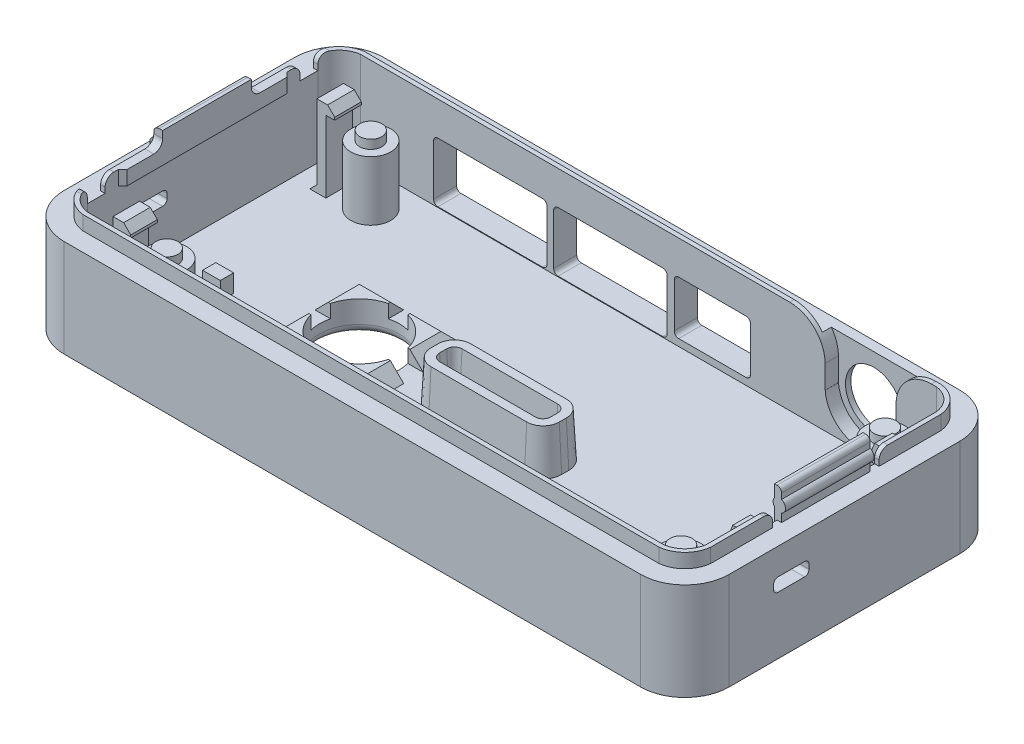
from build123d import *
from OCP.BRepFilletAPI import BRepFilletAPI_MakeChamfer

# Parameters (mm, degrees)
EXTRUDE_2_DEPTH       = 11
EXTRUDE_4_DEPTH       = 1.6
CUT_EXTRUDE_START     = -9
CUT_EXTRUDE_2_DEPTH   = 9
EXTRUDE_12_DEPTH      = 1.6
EXTRUDE_12_DEPTH_BACK = 2
SKETCH_5_W            = 0.3
SKETCH_5_H            = 10
SKETCH_15_R           = 2.25
EXTRUDE_13_DEPTH      = 6.7
SKETCH_16_R           = 1.25
EXTRUDE_14_DEPTH      = 1
SKETCH_17_W           = 0.5
SKETCH_17_H           = 1
CUT_EXTRUDE_3_DEPTH   = 1.6
SKETCH_19_W           = 0.8
SKETCH_19_H           = 10
EXTRUDE_15_DEPTH      = 1.8
SKETCH_20_R           = 0.7
EXTRUDE_16_DEPTH      = 10
FILLET_4_R            = 0.5
SKETCH_39_R           = 4
CUT_EXTRUDE_4_DEPTH   = 0.5
SKETCH_41_W           = 8.6
SKETCH_41_H           = 6
SKETCH_41_W_2         = 12.8
SKETCH_41_H_2         = 6.7
CUT_EXTRUDE_5_DEPTH   = 12
SKETCH_42_R           = 3.2
CUT_EXTRUDE_6_DEPTH   = 1.6
SKETCH_46_W           = 20
SKETCH_46_H           = 1.6
EXTRUDE_19_DEPTH      = 0.5
CHAMFER_3_SIZE        = 1
SKETCH_48_W           = 1
SKETCH_48_H           = 10
EXTRUDE_21_DEPTH      = 1.8
SKETCH_49_R           = 0.7
EXTRUDE_22_DEPTH      = 10
SKETCH_50_W           = 0.5
SKETCH_50_H           = 2
CUT_EXTRUDE_10_DEPTH  = 1.6
FILLET_9_R            = 1
FILLET_10_R           = 0.6
SKETCH_51_W           = 12
SKETCH_51_H           = 2
CUT_EXTRUDE_11_DEPTH  = 2
FILLET_13_R           = 0.6
SKETCH_52_W           = 9.2
SKETCH_52_H           = 9.2
EXTRUDE_23_DEPTH      = 1.5
CHAMFER_5_SIZE        = 1.5
CUT_EXTRUDE_12_REACH  = 47.339
SKETCH_53_R           = 4.5
FILLET_14_R           = 1
SKETCH_55_W           = 12.2
SKETCH_55_H           = 2.2
CUT_EXTRUDE_13_DEPTH  = 1.5
SKETCH_56_W           = 2.2
SKETCH_56_H           = 12.2
CUT_EXTRUDE_14_DEPTH  = 1.5
FILLET_17_R           = 1
SKETCH_63_W           = 2
SKETCH_63_H           = 1.5
EXTRUDE_24_DEPTH      = 2
FILLET_18_R           = 0.5
EXTRUDE_27_DEPTH      = 5
EXTRUDE_27_TAPER      = 3
CUT_EXTRUDE_15_DEPTH  = 0.5
CUT_EXTRUDE_16_REACH  = 80.462
SKETCH_67_W           = 4
SKETCH_67_H           = 1.5
FILLET_20_R           = 0.5
CUT_EXTRUDE_17_REACH  = 77.981
CUT_EXTRUDE_18_DEPTH  = 5
CUT_EXTRUDE_18_DRAFT  = 3
SKETCH_71_W           = 2
SKETCH_71_H           = 2
EXTRUDE_28_DEPTH      = 1.8
CHAMFER_6_SIZE        = 0.8
CHAMFER_6_SIZE2       = 1.980069483
SKETCH_73_W           = 1
SKETCH_73_H           = 3
EXTRUDE_30_DEPTH      = 9.2
SKETCH_74_W           = 3
SKETCH_74_H           = 1.1
EXTRUDE_31_DEPTH      = 1
CHAMFER_7_SIZE        = 0.8
CUT_EXTRUDE_START_2   = -1.5
SKETCH_75_R           = 4
CUT_EXTRUDE_19_DEPTH  = 1.5
SKETCH_76_W           = 8
SKETCH_76_H           = 6.611690882
CUT_EXTRUDE_20_DEPTH  = 1.5
FILLET_21_R           = 4


# Some blends are built 0.0001 mm under size
with BuildPart() as part:
    # case 2 → 凸台-拉伸2 (new body)
    with BuildSketch(Plane(origin=(0, 0, 0), x_dir=(1, 0, 0), z_dir=(0, 1, 0))):
        with BuildLine():
            Line((-34.042196447, 18), (30.957803553, 18))
            ThreePointArc((30.957803553, 18), (34.493337459, 16.535533906), (35.957803553, 13))
            Line((35.957803553, 13), (35.957803553, -13))
            ThreePointArc((35.957803553, -13), (34.493337459, -16.535533906), (30.957803553, -18))
            Line((30.957803553, -18), (-34.042196447, -18))
            ThreePointArc((-34.042196447, -18), (-37.577730353, -16.535533906), (-39.042196447, -13))
            Line((-39.042196447, -13), (-39.042196447, 13))
            ThreePointArc((-39.042196447, 13), (-37.577730353, 16.535533906), (-34.042196447, 18))
        make_face()
    extrude(amount=EXTRUDE_2_DEPTH)

    # 草图3 → 凸台-拉伸4 (add)
    with BuildSketch(Plane(origin=(0, 11, 0), x_dir=(1, 0, 0), z_dir=(0, 1, 0))):
        with BuildLine():
            Line((-36.942196447, 13), (-36.942196447, -13))
            ThreePointArc((-36.942196447, -13), (-35.997398295, -14.955201848), (-34.042196447, -15.9))
            Line((-34.042196447, -15.9), (30.957803553, -15.9))
            ThreePointArc((30.957803553, -15.9), (32.913005401, -14.955201848), (33.857803553, -13))
            Line((33.857803553, -13), (33.857803553, 13))
            ThreePointArc((33.857803553, 13), (32.913005401, 14.955201848), (30.957803553, 15.9))
            Line((30.957803553, 15.9), (-34.042196447, 15.9))
            ThreePointArc((-34.042196447, 15.9), (-35.997398295, 14.955201848), (-36.942196447, 13))
        make_face()
        with BuildLine():
            Line((-34.042196447, -15.4), (30.957803553, -15.4))
            ThreePointArc((30.957803553, -15.4), (32.562900965, -14.605097413), (33.357803553, -13))
            Line((33.357803553, -13), (33.357803553, 13))
            ThreePointArc((33.357803553, 13), (32.562900965, 14.605097413), (30.957803553, 15.4))
            Line((30.957803553, 15.4), (-34.042196447, 15.4))
            ThreePointArc((-34.042196447, 15.4), (-35.64729386, 14.605097413), (-36.442196447, 13))
            Line((-36.442196447, 13), (-36.442196447, -13))
            ThreePointArc((-36.442196447, -13), (-35.64729386, -14.605097413), (-34.042196447, -15.4))
        make_face(mode=Mode.SUBTRACT)
    extrude(amount=EXTRUDE_4_DEPTH)

    # 草图14 → 切除-拉伸2 (cut)
    with BuildSketch(Plane(origin=(0, 11, 0), x_dir=(1, 0, 0), z_dir=(0, 1, 0)).offset(CUT_EXTRUDE_START)):
        with BuildLine():
            Line((-34.042196447, -15.4), (30.957803553, -15.4))
            ThreePointArc((30.957803553, -15.4), (32.562900965, -14.605097413), (33.357803553, -13))
            Line((33.357803553, -13), (33.357803553, 13))
            ThreePointArc((33.357803553, 13), (32.562900965, 14.605097413), (30.957803553, 15.4))
            Line((30.957803553, 15.4), (-34.042196447, 15.4))
            ThreePointArc((-34.042196447, 15.4), (-35.64729386, 14.605097413), (-36.442196447, 13))
            Line((-36.442196447, 13), (-36.442196447, -13))
            ThreePointArc((-36.442196447, -13), (-35.64729386, -14.605097413), (-34.042196447, -15.4))
        make_face()
    extrude(amount=CUT_EXTRUDE_2_DEPTH, mode=Mode.SUBTRACT)

    # 草图5 → 凸台-拉伸12 (add, two sides: drawn at the far end of the back side and taken through both)
    with BuildSketch(Plane(origin=(0, 11, 0), x_dir=(1, 0, 0), z_dir=(0, 1, 0)).offset(-EXTRUDE_12_DEPTH_BACK)):
        with Locations((33.207803553, 0)):
            Rectangle(SKETCH_5_W, SKETCH_5_H)
    extrude(amount=EXTRUDE_12_DEPTH + EXTRUDE_12_DEPTH_BACK)

    # 草图15 → 凸台-拉伸13 (add)
    with BuildSketch(Plane(origin=(0, 2, 0), x_dir=(1, 0, 0), z_dir=(0, 1, 0))):
        with Locations(Location((29.060337171, -11.529492838, 0), (0, 0, 270))):
            Circle(SKETCH_15_R)
        with Locations(Location((-28.939662829, -11.529492838, 0), (0, 0, 270))):
            Circle(SKETCH_15_R)
        with Locations(Location((29.060337171, 11.470507162, 0), (0, 0, 270))):
            Circle(SKETCH_15_R)
        with Locations(Location((-28.939662829, 11.470507162, 0), (0, 0, 270))):
            Circle(SKETCH_15_R)
    extrude(amount=EXTRUDE_13_DEPTH)

    # 草图16 → 凸台-拉伸14 (add)
    with BuildSketch(Plane(origin=(0, 8.7, 0), x_dir=(1, 0, 0), z_dir=(0, 1, 0))):
        with Locations(Location((29.060337171, -11.529492838, 0), (0, 0, 270))):
            Circle(SKETCH_16_R)
        with Locations(Location((29.060337171, 11.470507162, 0), (0, 0, 270))):
            Circle(SKETCH_16_R)
        with Locations(Location((-28.939662829, -11.529492838, 0), (0, 0, 270))):
            Circle(SKETCH_16_R)
        with Locations(Location((-28.939662829, 11.470507162, 0), (0, 0, 270))):
            Circle(SKETCH_16_R)
    extrude(amount=EXTRUDE_14_DEPTH)

    # 草图17 → 切除-拉伸3 (cut)
    with BuildSketch(Plane(origin=(0, 12.6, 0), x_dir=(1, 0, 0), z_dir=(0, 1, 0))):
        with Locations((33.607803553, -5.5)):
            Rectangle(SKETCH_17_W, SKETCH_17_H)
        with Locations((33.607803553, 5.5)):
            Rectangle(SKETCH_17_W, SKETCH_17_H)
    extrude(amount=-CUT_EXTRUDE_3_DEPTH, mode=Mode.SUBTRACT)

    # 草图19 → 凸台-拉伸15 (add)
    with BuildSketch(Plane(origin=(0, 12.6, 0), x_dir=(1, 0, 0), z_dir=(0, 1, 0))):
        with Locations((33.457803553, 0)):
            Rectangle(SKETCH_19_W, SKETCH_19_H)
    extrude(amount=EXTRUDE_15_DEPTH)

    # 草图20 → 凸台-拉伸16 (add)
    with BuildSketch(Plane(origin=(0, 0, -5), x_dir=(-1, 0, 0), z_dir=(0, 0, -1))):
        with Locations((-33.607803553, 12.6)):
            Circle(SKETCH_20_R)
    extrude(amount=-EXTRUDE_16_DEPTH)

    # 圆角4
    fillet_4_edges = [part.edges().sort_by_distance(p)[0] for p in [
        (33.857803553, 14.4, 0),
    ]]
    fillet(fillet_4_edges, radius=FILLET_4_R)

    # 草图39 → 切除-拉伸4 (cut)
    with BuildSketch(Plane(origin=(0, 0, -18), x_dir=(-1, 0, 0), z_dir=(0, 0, -1))):
        with Locations((-22.372090091, 6.27888613)):
            Circle(SKETCH_39_R)
    extrude(amount=-CUT_EXTRUDE_4_DEPTH, mode=Mode.SUBTRACT)

    # 草图41 → 切除-拉伸5 (cut)
    with BuildSketch(Plane(origin=(0, 0, -18), x_dir=(-1, 0, 0), z_dir=(0, 0, -1))):
        with Locations((-5.657803553, 5.77888613)):
            Rectangle(SKETCH_41_W, SKETCH_41_H)
        with Locations((5.842196447, 5.42888613)):
            Rectangle(SKETCH_41_W_2, SKETCH_41_H_2)
        with Locations((19.392196447, 5.42888613)):
            Rectangle(SKETCH_41_W_2, SKETCH_41_H_2)
    extrude(amount=-CUT_EXTRUDE_5_DEPTH, mode=Mode.SUBTRACT)

    # 草图42 → 切除-拉伸6 (cut)
    with BuildSketch(Plane(origin=(0, 0, -17.5), x_dir=(-1, 0, 0), z_dir=(0, 0, -1))):
        with Locations((-22.372090091, 6.27888613)):
            Circle(SKETCH_42_R)
    extrude(amount=-CUT_EXTRUDE_6_DEPTH, mode=Mode.SUBTRACT)

    # 草图46 → 凸台-拉伸19 (add)
    with BuildSketch(Plane(origin=(-36.442196447, 0, 0), x_dir=(0, 0, -1), z_dir=(1, 0, 0))):
        with Locations((0, 11.8)):
            Rectangle(SKETCH_46_W, SKETCH_46_H)
    extrude(amount=EXTRUDE_19_DEPTH)

    # 倒角3
    # the kernel refuses this chamfer: 1 mm, written as the material it takes off along each edge
    with BuildSketch(Plane(origin=(-35.942196447, 15.171682988, -10), x_dir=(-0.9996219169112968, 0, -0.02749587661058555), z_dir=(0, -1, 0))) as chamfer_3_piece_1_section:
        Polygon((CHAMFER_3_SIZE * 0.999621916911, -CHAMFER_3_SIZE * 0.0274958766106), (-CHAMFER_3_SIZE * 0.0274958766106, -CHAMFER_3_SIZE * 0.999621916911), (0, 0), align=None)
    chamfer_3_piece_1 = extrude(amount=6.743365976, mode=Mode.PRIVATE)
    chamfer_3_piece_1 = split(chamfer_3_piece_1, bisect_by=Plane(origin=(-36.442196447, 11.8, -9.606598916), z_dir=(1, 0, 0)), keep=Keep.TOP, mode=Mode.PRIVATE)
    add(chamfer_3_piece_1, mode=Mode.SUBTRACT)
    with BuildSketch(Plane(origin=(-35.942196447, 8.428317012, 10), x_dir=(-0.9996219169112968, 0, 0.02749587661058555), z_dir=(0, 1, 0))) as chamfer_3_piece_2_section:
        Polygon((CHAMFER_3_SIZE * 0.999621916911, -CHAMFER_3_SIZE * 0.0274958766106), (-CHAMFER_3_SIZE * 0.0274958766106, -CHAMFER_3_SIZE * 0.999621916911), (0, 0), align=None)
    chamfer_3_piece_2 = extrude(amount=6.743365976, mode=Mode.PRIVATE)
    chamfer_3_piece_2 = split(chamfer_3_piece_2, bisect_by=Plane(origin=(-36.442196447, 11.8, 9.606598916), z_dir=(1, 0, 0)), keep=Keep.TOP, mode=Mode.PRIVATE)
    add(chamfer_3_piece_2, mode=Mode.SUBTRACT)

    # 草图48 → 凸台-拉伸21 (add)
    with BuildSketch(Plane(origin=(0, 12.6, 0), x_dir=(1, 0, 0), z_dir=(0, 1, 0))):
        with Locations((-36.442196447, 0)):
            Rectangle(SKETCH_48_W, SKETCH_48_H)
    extrude(amount=EXTRUDE_21_DEPTH)

    # 草图49 → 凸台-拉伸22 (add)
    with BuildSketch(Plane.XY.offset(5)):
        with Locations((-36.692196447, 12.6)):
            Circle(SKETCH_49_R)
    extrude(amount=-EXTRUDE_22_DEPTH)

    # 草图50 → 切除-拉伸10 (cut)
    with BuildSketch(Plane(origin=(0, 12.6, 0), x_dir=(1, 0, 0), z_dir=(0, 1, 0))):
        with Locations((-36.692196447, 12)):
            Rectangle(SKETCH_50_W, SKETCH_50_H)
        with Locations((-36.692196447, -12)):
            Rectangle(SKETCH_50_W, SKETCH_50_H)
    extrude(amount=-CUT_EXTRUDE_10_DEPTH, mode=Mode.SUBTRACT)

    # 圆角9
    fillet_9_edges = [part.edges().sort_by_distance(p)[0] for p in [
        (33.607803553, 12.6, 6),
        (33.607803553, 12.6, -6),
        (-36.692196447, 12.6, -13),
        (-36.692196447, 12.6, -11),
        (-36.692196447, 12.6, 11),
        (-36.692196447, 12.6, 13),
    ]]
    fillet(fillet_9_edges, radius=FILLET_9_R)

    # 圆角10
    fillet_10_edges = [part.edges().sort_by_distance(p)[0] for p in [
        (-36.942196447, 14.4, 0),
    ]]
    fillet(fillet_10_edges, radius=FILLET_10_R)

    # 草图51 → 切除-拉伸11 (cut)
    with BuildSketch(Plane.XZ):
        with Locations((0.257803553, 3.3)):
            Rectangle(SKETCH_51_W, SKETCH_51_H)
    extrude(amount=-CUT_EXTRUDE_11_DEPTH, mode=Mode.SUBTRACT)

    # 圆角13
    fillet_13_edges = [part.edges().sort_by_distance(p)[0] for p in [
        (6.257803553, 1, 4.3),
        (6.257803553, 1, 2.3),
        (-5.742196447, 1, 2.3),
        (-5.742196447, 1, 4.3),
    ]]
    fillet(fillet_13_edges, radius=FILLET_13_R)

    # 草图52 → 凸台-拉伸23 (add)
    with BuildSketch(Plane(origin=(0, 2, 0), x_dir=(1, 0, 0), z_dir=(0, 1, 0))):
        with Locations((-16.127909909, -2.629492838)):
            Rectangle(SKETCH_52_W, SKETCH_52_H)
    extrude(amount=EXTRUDE_23_DEPTH)

    # 倒角5
    chamfer_5_edges = [part.edges().sort_by_distance(p)[0] for p in [
        (-16.127909909, 2, -1.970507162),
        (-11.527909909, 2, 2.629492838),
        (-16.127909909, 2, 7.229492838),
        (-20.727909909, 2, 2.629492838),
    ]]
    chamfer(chamfer_5_edges, length=CHAMFER_5_SIZE - 0.0001)  # a hair under: the kernel refuses the full size

    # 草图53 → 切除-拉伸12 (cut, up to next)
    with BuildSketch(Plane.XZ, mode=Mode.PRIVATE) as cut_extrude_12_sk1:
        with Locations(Location((-16.127909909, 2.629492838, 0), (0, 0, 270))):
            Circle(SKETCH_53_R)
    cut_extrude_12_tool1 = extrude(cut_extrude_12_sk1.sketch, amount=-CUT_EXTRUDE_12_REACH, mode=Mode.PRIVATE) & part.part
    add(cut_extrude_12_tool1.solids().sort_by_distance((-16.12791, 0, 2.629493))[0], mode=Mode.SUBTRACT)

    # 圆角14
    fillet_14_edges = [part.edges().sort_by_distance(p)[0] for p in [
        (-16.127909909, 0, 7.129492838),
    ]]
    fillet(fillet_14_edges, radius=FILLET_14_R)

    # 草图55 → 切除-拉伸13 (cut)
    with BuildSketch(Plane(origin=(0, 3.5, 0), x_dir=(1, 0, 0), z_dir=(0, 1, 0))):
        with Locations((-16.127909909, -2.629492838)):
            Rectangle(SKETCH_55_W, SKETCH_55_H)
    extrude(amount=-CUT_EXTRUDE_13_DEPTH, mode=Mode.SUBTRACT)

    # 草图56 → 切除-拉伸14 (cut)
    with BuildSketch(Plane(origin=(0, 3.5, 0), x_dir=(1, 0, 0), z_dir=(0, 1, 0))):
        with Locations((-16.127909909, -2.629492838)):
            Rectangle(SKETCH_56_W, SKETCH_56_H)
    extrude(amount=-CUT_EXTRUDE_14_DEPTH, mode=Mode.SUBTRACT)

    # 圆角17
    # the kernel refuses this fillet: 1 mm, written as the material it adds along each edge
    with BuildSketch(Plane(origin=(-36.942196447, 12.6, -5), x_dir=(0, 0, -1), z_dir=(1, 0, 0)), Plane(origin=(-35.942196447, 12.6, 5), x_dir=(0, 0, 1), z_dir=(-1, 0, 0))) as fillet_17_piece_1:
        with BuildLine():
            CenterArc((FILLET_17_R, FILLET_17_R), FILLET_17_R, 180, 90)
            Line((0, FILLET_17_R), (0, 0))
            Line((0, 0), (FILLET_17_R, 0))
        make_face()
    extrude(amount=1)

    # 草图63 → 凸台-拉伸24 (add)
    with BuildSketch(Plane(origin=(0, 2, 0), x_dir=(1, 0, 0), z_dir=(0, 1, 0))):
        with Locations((-29.442196447, -5.25)):
            Rectangle(SKETCH_63_W, SKETCH_63_H)
    extrude(amount=EXTRUDE_24_DEPTH)

    # 圆角18
    fillet_18_edges = [part.edges().sort_by_distance(p)[0] for p in [
        (9.957803553, 2.77888613, -16.7),
        (9.957803553, 8.77888613, -16.7),
        (1.357803553, 8.77888613, -16.7),
        (1.357803553, 2.77888613, -16.7),
        (0.557803553, 2.07888613, -16.7),
        (0.557803553, 8.77888613, -16.7),
        (-12.242196447, 8.77888613, -16.7),
        (-12.242196447, 2.07888613, -16.7),
        (-12.992196447, 2.07888613, -16.7),
        (-12.992196447, 8.77888613, -16.7),
        (-25.792196447, 8.77888613, -16.7),
        (-25.792196447, 2.07888613, -16.7),
    ]]
    fillet(fillet_18_edges, radius=FILLET_18_R)

    # 草图66 → 凸台-拉伸27 (add)
    with BuildSketch(Plane(origin=(0, 2, 0), x_dir=(1, 0, 0), z_dir=(0, 1, 0))):
        with BuildLine():
            ThreePointArc((-5.142196447, -0.8), (-6.627120688, -1.41507576), (-7.242196447, -2.9))
            Line((-7.242196447, -2.9), (-7.242196447, -3.7))
            ThreePointArc((-7.242196447, -3.7), (-6.627120688, -5.18492424), (-5.142196447, -5.8))
            Line((-5.142196447, -5.8), (5.657803553, -5.8))
            ThreePointArc((5.657803553, -5.8), (7.142727793, -5.18492424), (7.757803553, -3.7))
            Line((7.757803553, -3.7), (7.757803553, -2.9))
            ThreePointArc((7.757803553, -2.9), (7.142727793, -1.41507576), (5.657803553, -0.8))
            Line((5.657803553, -0.8), (-5.142196447, -0.8))
        make_face()
    extrude(amount=EXTRUDE_27_DEPTH, taper=EXTRUDE_27_TAPER)

    # 草图62 → 切除-拉伸15 (cut)
    with BuildSketch(Plane.XZ):
        with BuildLine():
            Line((31.329867206, 13.332415894), (30.916899455, 13.564201315))
            Line((30.916899455, 13.564201315), (28.77453702, 14.767807833))
            Line((28.77453702, 14.767807833), (28.361536611, 15.002445177))
            add(Edge.make_bspline(
                [(28.361536611, 15.002445177), (28.226752403, 15.074974446), (28.078169451, 15.113170304), (27.930008551, 15.111473614)],
                knots=[3, 3, 3, 3, 4, 4, 4, 4], degree=3))
            add(Edge.make_bspline(
                [(27.930008551, 15.111473614), (27.781847651, 15.109776925), (27.634143582, 15.068188087), (27.501090445, 14.992591634)],
                knots=[4, 4, 4, 4, 5, 5, 5, 5], degree=3))
            Line((27.501090445, 14.992591634), (27.093536837, 14.748557578))
            Line((27.093536837, 14.748557578), (24.979299219, 13.496205892))
            Line((24.979299219, 13.496205892), (24.571712952, 13.255023759))
            add(Edge.make_bspline(
                [(24.571712952, 13.255023759), (24.308524118, 13.098142275), (24.146514419, 12.811335524), (24.150005577, 12.506475344)],
                knots=[8, 8, 8, 8, 9, 9, 9, 9], degree=3))
            Line((24.150005577, 12.506475344), (24.189028038, 9.098896372))
            add(Edge.make_bspline(
                [(24.189028038, 9.098896372), (24.192551656, 8.791201658), (24.361054378, 8.511014731), (24.627766829, 8.3602015)],
                knots=[10, 10, 10, 10, 11, 11, 11, 11], degree=3))
            Line((24.627766829, 8.3602015), (25.040769358, 8.128416478))
            Line((25.040769358, 8.128416478), (27.183131793, 6.924809959))
            Line((27.183131793, 6.924809959), (27.596166783, 6.690190404))
            add(Edge.make_bspline(
                [(27.596166783, 6.690190404), (27.73094907, 6.614791423), (27.879534142, 6.579447887), (28.027695042, 6.581144577)],
                knots=[14, 14, 14, 14, 15, 15, 15, 15], degree=3))
            add(Edge.make_bspline(
                [(28.027695042, 6.581144577), (28.175855942, 6.582841266), (28.323557891, 6.621577782), (28.456612949, 6.700043947)],
                knots=[15, 15, 15, 15, 16, 16, 16, 16], degree=3))
            Line((28.456612949, 6.700043947), (28.864131976, 6.944060215))
            Line((28.864131976, 6.944060215), (30.978369595, 8.196411901))
            Line((30.978369595, 8.196411901), (31.385921082, 8.437593635))
            add(Edge.make_bspline(
                [(31.385921082, 8.437593635), (31.651996619, 8.594508177), (31.811152075, 8.878447337), (31.807628458, 9.186142051)],
                knots=[19, 19, 19, 19, 20, 20, 20, 20], degree=3))
            Line((31.807628458, 9.186142051), (31.768605996, 12.593721022))
            add(Edge.make_bspline(
                [(31.768605996, 12.593721022), (31.765114839, 12.898581203), (31.59946636, 13.181635722), (31.329867206, 13.332415894)],
                knots=[21, 21, 21, 21, 22, 22, 22, 22], degree=3))
        make_face()
        with BuildLine():
            Line((25.122643227, 12.922239884), (27.737823659, 14.473836564))
            add(Edge.make_bspline(
                [(27.737823659, 14.473836564), (27.859536342, 14.546468245), (28.013401089, 14.548230253), (28.139562287, 14.478437141)],
                knots=[3, 3, 3, 3, 4, 4, 4, 4], degree=3))
            Line((28.139562287, 14.478437141), (30.775362017, 12.984120643))
            add(Edge.make_bspline(
                [(30.775362017, 12.984120643), (30.910144104, 12.908739052), (30.915214668, 12.715032206), (30.782227048, 12.633714516)],
                knots=[5, 5, 5, 5, 6, 6, 6, 6], degree=3))
            Line((30.782227048, 12.633714516), (28.255386484, 11.083146867))
            add(Edge.make_bspline(
                [(28.255386484, 11.083146867), (28.085552276, 10.981458533), (27.871866696, 10.979011477), (27.69978311, 11.076784282)],
                knots=[7, 7, 7, 7, 8, 8, 8, 8], degree=3))
            add(Edge.make_bspline(
                [(27.69978311, 11.076784282), (25.107151823, 12.534532657), (25.101415317, 12.537319262)],
                knots=[0, 0, 0, 1, 1, 1], degree=2))
            add(Edge.make_bspline(
                [(25.101415317, 12.537319262), (24.966404814, 12.632646927), (24.978280374, 12.837957024), (25.122643227, 12.922239884)],
                knots=[1, 1, 1, 1, 2, 2, 2, 2], degree=3))
        make_face(mode=Mode.SUBTRACT)
        with BuildLine():
            Line((29.074132094, 8.513698152), (28.779702541, 8.345067112))
            Line((28.779702541, 8.345067112), (28.773503452, 8.88639348))
            Line((28.773503452, 8.88639348), (29.034101238, 9.020461697))
            add(Edge.make_bspline(
                [(29.504843801, 9.718282469), (29.507943445, 9.44761059), (29.35685407, 9.20653087), (29.034101238, 9.020461697)],
                knots=[0, 0, 0, 0, 1, 1, 1, 1], degree=3))
            add(Edge.make_bspline(
                [(29.008019278, 9.806631855), (29.325033683, 9.992617921), (29.501646378, 9.997492729), (29.504843801, 9.718282469)],
                knots=[6, 6, 6, 6, 7, 7, 7, 7], degree=3))
            Line((29.008019278, 9.806631855), (28.764563572, 9.667055349))
            add(Edge.make_bspline(
                [(28.736598948, 9.618298227), (28.736370532, 9.638244301), (28.74754981, 9.658321013), (28.764563572, 9.667055349)],
                knots=[4, 4, 4, 4, 5, 5, 5, 5], degree=3))
            Line((28.736598948, 9.618298227), (28.74429897, 8.94590511))
            Line((28.74429897, 8.94590511), (28.751738116, 8.296292601))
            Line((28.751738116, 8.296292601), (28.761526341, 7.441550282))
            add(Edge.make_bspline(
                [(28.761526341, 7.441550282), (28.761754757, 7.421604207), (28.753429523, 7.404412477), (28.733631276, 7.392793957)],
                knots=[3, 3, 3, 3, 4, 4, 4, 4], degree=3))
            Line((28.733631276, 7.392793957), (28.184468761, 7.07306547))
            add(Edge.make_bspline(
                [(28.184468761, 7.07306547), (28.147656952, 7.052695223), (28.101767421, 7.077805604), (28.10127793, 7.120549676)],
                knots=[5, 5, 5, 5, 6, 6, 6, 6], degree=3))
            Line((28.10127793, 7.120549676), (28.071064911, 9.758857083))
            add(Edge.make_bspline(
                [(28.071064911, 9.758857083), (28.070836495, 9.778803157), (28.07916385, 9.798847209), (28.098994756, 9.807613806)],
                knots=[7, 7, 7, 7, 8, 8, 8, 8], degree=3))
            Line((28.098994756, 9.807613806), (29.033123907, 10.351169))
            add(Edge.make_bspline(
                [(29.033123907, 10.351169), (29.638896279, 10.702903644), (30.142382006, 10.777054965), (30.150212666, 10.093254154)],
                knots=[9, 9, 9, 9, 10, 10, 10, 10], degree=3))
            add(Edge.make_bspline(
                [(30.150212666, 10.093254154), (30.157749591, 9.435103264), (29.654400253, 8.850896635), (29.074132094, 8.513698152)],
                knots=[10, 10, 10, 10, 11, 11, 11, 11], degree=3))
        make_face(mode=Mode.SUBTRACT)
        with BuildLine():
            Line((31.023729103, 8.712692808), (30.480272555, 8.395881962))
            add(Edge.make_bspline(
                [(30.480272555, 8.395881962), (30.443460746, 8.375511715), (30.397571016, 8.400639486), (30.397081724, 8.443366168)],
                knots=[2, 2, 2, 2, 3, 3, 3, 3], degree=3))
            Line((30.397081724, 8.443366168), (30.382692922, 9.699847115))
            add(Edge.make_bspline(
                [(30.382692922, 9.699847115), (30.382464706, 9.7197758), (30.393676444, 9.737017977), (30.410657546, 9.748604237)],
                knots=[4, 4, 4, 4, 5, 5, 5, 5], degree=3))
            Line((30.410657546, 9.748604237), (30.954146555, 10.06258055))
            add(Edge.make_bspline(
                [(30.954146555, 10.06258055), (30.990958563, 10.082933407), (31.036848093, 10.057823026), (31.037337584, 10.015078954)],
                knots=[6, 6, 6, 6, 7, 7, 7, 7], degree=3))
            Line((31.037337584, 10.015078954), (31.051693528, 8.76146732))
            add(Edge.make_bspline(
                [(31.051693528, 8.76146732), (31.051921944, 8.741521246), (31.040742666, 8.721444534), (31.023729103, 8.712692808)],
                knots=[0, 0, 0, 0, 1, 1, 1, 1], degree=3))
        make_face(mode=Mode.SUBTRACT)
        with BuildLine():
            add(Edge.make_bspline(
                [(30.699564788, 10.894570885), (30.9175186, 11.022446162), (31.07482042, 10.970106055), (31.077104379, 10.770662702), (31.079355678, 10.574071274), (30.9253166, 10.341497274), (30.707330129, 10.21647392)],
                knots=[2, 2, 2, 2, 3, 3, 3, 4, 4, 4, 4], degree=3))
            add(Edge.make_bspline(
                [(30.707330129, 10.21647392), (30.486591832, 10.085714459), (30.329255233, 10.138054168), (30.327003933, 10.334645596), (30.324687315, 10.536940872), (30.478793832, 10.766663346), (30.699564788, 10.894570885)],
                knots=[0, 0, 0, 0, 1, 1, 1, 2, 2, 2, 2], degree=3))
        make_face(mode=Mode.SUBTRACT)
    extrude(amount=-CUT_EXTRUDE_15_DEPTH, mode=Mode.SUBTRACT)

    # 草图67 → 切除-拉伸16 (cut, up to next)
    with BuildSketch(Plane.ZY.offset(39.042196447), mode=Mode.PRIVATE) as cut_extrude_16_sk1:
        with Locations((6, 7.25)):
            Rectangle(SKETCH_67_W, SKETCH_67_H)
    cut_extrude_16_tool1 = extrude(cut_extrude_16_sk1.sketch, amount=-CUT_EXTRUDE_16_REACH, mode=Mode.PRIVATE) & part.part
    add(cut_extrude_16_tool1.solids().sort_by_distance((-39.042196, 7.25, 6))[0], mode=Mode.SUBTRACT)

    # 圆角20
    fillet_20_edges = [part.edges().sort_by_distance(p)[0] for p in [
        (-37.742196447, 6.5, 4),
        (-37.742196447, 8, 4),
        (-37.742196447, 8, 8),
        (-37.742196447, 6.5, 8),
    ]]
    fillet(fillet_20_edges, radius=FILLET_20_R)

    # 草图68 → 切除-拉伸17 (cut, up to next)
    with BuildSketch(Plane.ZY.offset(-33.357803553), mode=Mode.PRIVATE) as cut_extrude_17_sk1:
        with BuildLine():
            Line((8, 7), (8, 7.5))
            ThreePointArc((8, 7.5), (7.853553391, 7.853553391), (7.5, 8))
            Line((7.5, 8), (4.5, 8))
            ThreePointArc((4.5, 8), (4.146446609, 7.853553391), (4, 7.5))
            Line((4, 7.5), (4, 7))
            ThreePointArc((4, 7), (4.146446609, 6.646446609), (4.5, 6.5))
            Line((4.5, 6.5), (7.5, 6.5))
            ThreePointArc((7.5, 6.5), (7.853553391, 6.646446609), (8, 7))
        make_face()
    cut_extrude_17_tool1 = extrude(cut_extrude_17_sk1.sketch, amount=-CUT_EXTRUDE_17_REACH, mode=Mode.PRIVATE) & part.part
    add(cut_extrude_17_tool1.solids().sort_by_distance((33.357804, 7.25, 6))[0], mode=Mode.SUBTRACT)


with BuildPart() as cut_extrude_18_tool:
    # 草图70 → 切除-拉伸18 (with draft: the straight prism first)
    with BuildSketch(Plane.XZ.offset(-2)):
        with BuildLine():
            Line((6.257803553, 2.9), (6.257803553, 3.7))
            ThreePointArc((6.257803553, 3.7), (6.082067621, 4.124264069), (5.657803553, 4.3))
            Line((5.657803553, 4.3), (-5.142196447, 4.3))
            ThreePointArc((-5.142196447, 4.3), (-5.566460516, 4.124264069), (-5.742196447, 3.7))
            Line((-5.742196447, 3.7), (-5.742196447, 2.9))
            ThreePointArc((-5.742196447, 2.9), (-5.566460516, 2.475735931), (-5.142196447, 2.3))
            Line((-5.142196447, 2.3), (5.657803553, 2.3))
            ThreePointArc((5.657803553, 2.3), (6.082067621, 2.475735931), (6.257803553, 2.9))
        make_face()
    extrude(amount=-CUT_EXTRUDE_18_DEPTH)
    # 切除-拉伸18: the draft: its side faces are tilted about the plane it starts from
    cut_extrude_18_sides = [cut_extrude_18_tool.faces().sort_by_distance(p)[0] for p in [
        (6.257803553, 4.5, 3.3),
        (6.082067621, 4.5, 4.124264069),
        (0.257803553, 4.5, 4.3),
        (-5.566460516, 4.5, 4.124264069),
        (-5.742196447, 4.5, 3.3),
        (-5.566460516, 4.5, 2.475735931),
        (0.257803553, 4.5, 2.3),
        (6.082067621, 4.5, 2.475735931),
    ]]
    draft(cut_extrude_18_sides, Plane.XZ.offset(-2), CUT_EXTRUDE_18_DRAFT)


with BuildPart() as part_1:
    add(part.part)

    # 切除-拉伸18: cut by cut_extrude_18_tool
    add(cut_extrude_18_tool.part, mode=Mode.SUBTRACT)

    # 草图71 → 凸台-拉伸28 (add)
    with BuildSketch(Plane.ZY.offset(-33.357803553)):
        with Locations((-8, 11)):
            Rectangle(SKETCH_71_W, SKETCH_71_H)
        with Locations((8, 11)):
            Rectangle(SKETCH_71_W, SKETCH_71_H)
    extrude(amount=EXTRUDE_28_DEPTH)

    # 倒角6: one chamfer whose edges measure the first distance from different faces: ONE call of the kernel's chamfer builder (chamfer() names one face for all edges)
    chamfer_6_edges_1 = [part_1.edges().sort_by_distance(p)[0] for p in [
        (31.557803553, 12, -8),
    ]]
    chamfer_6_side_1 = [part_1.faces().sort_by_distance(p)[0] for p in [
        (32.457803553, 12, -8),
    ]]
    chamfer_6_edges_2 = [part_1.edges().sort_by_distance(p)[0] for p in [
        (31.557803553, 12, 8),
    ]]
    chamfer_6_side_2 = [part_1.faces().sort_by_distance(p)[0] for p in [
        (32.457803553, 12, 8),
    ]]
    chamfer_6 = BRepFilletAPI_MakeChamfer(part_1.part.solid().wrapped)
    for e in chamfer_6_edges_1:
        chamfer_6.Add(CHAMFER_6_SIZE, CHAMFER_6_SIZE2, e.wrapped, chamfer_6_side_1[0].wrapped)  # the first distance lies on this face
    for e in chamfer_6_edges_2:
        chamfer_6.Add(CHAMFER_6_SIZE, CHAMFER_6_SIZE2, e.wrapped, chamfer_6_side_2[0].wrapped)  # the first distance lies on this face
    add(Compound.cast(chamfer_6.Shape()), mode=Mode.REPLACE)

    # 草图73 → 凸台-拉伸30 (add)
    with BuildSketch(Plane(origin=(0, 2, 0), x_dir=(1, 0, 0), z_dir=(0, 1, 0))):
        with Locations((-33.042196447, 11.5)):
            Rectangle(SKETCH_73_W, SKETCH_73_H)
        with Locations((-33.042196447, -11.5)):
            Rectangle(SKETCH_73_W, SKETCH_73_H)
    extrude(amount=EXTRUDE_30_DEPTH)

    # 草图74 → 凸台-拉伸31 (add)
    with BuildSketch(Plane(origin=(-32.542196447, 0, 0), x_dir=(0, 0, -1), z_dir=(1, 0, 0))):
        with Locations((11.5, 10.65)):
            Rectangle(SKETCH_74_W, SKETCH_74_H)
        with Locations((-11.5, 10.65)):
            Rectangle(SKETCH_74_W, SKETCH_74_H)
    extrude(amount=EXTRUDE_31_DEPTH)

    # 倒角7
    chamfer_7_edges = [part_1.edges().sort_by_distance(p)[0] for p in [
        (-33.542196447, 2, -11.5),
        (-33.542196447, 2, 11.5),
        (-31.542196447, 11.2, -11.5),
        (-31.542196447, 11.2, 11.5),
    ]]
    chamfer(chamfer_7_edges, length=CHAMFER_7_SIZE)

    # 草图75 → 切除-拉伸19 (cut)
    with BuildSketch(Plane.XY.offset(-15.4).offset(CUT_EXTRUDE_START_2)):
        with Locations(Location((22.372090091, 6.27888613, 0), (0, 0, 180))):
            Circle(SKETCH_75_R)
    extrude(amount=CUT_EXTRUDE_19_DEPTH, mode=Mode.SUBTRACT)

    # 草图76 → 切除-拉伸20 (cut)
    with BuildSketch(Plane.XY.offset(-15.4)):
        with Locations((22.372090091, 9.294154559)):
            Rectangle(SKETCH_76_W, SKETCH_76_H)
    extrude(amount=-CUT_EXTRUDE_20_DEPTH, mode=Mode.SUBTRACT)

    # 圆角21
    # the kernel refuses this fillet: 4 mm, written as the material it takes off along each edge
    with BuildSketch(Plane(origin=(18.372090091, 12.6, -5.4), x_dir=(0, -1, 0), z_dir=(0, 0, -1))) as fillet_21_piece_1_section:
        with BuildLine():
            CenterArc((FILLET_21_R, FILLET_21_R), FILLET_21_R, 180, 90)
            Line((0, FILLET_21_R), (0, 0))
            Line((0, 0), (FILLET_21_R, 0))
        make_face()
    fillet_21_piece_1 = extrude(amount=20.5, mode=Mode.PRIVATE)
    fillet_21_piece_1 = split(fillet_21_piece_1, bisect_by=Plane(origin=(18.13685054, 10.412662438, -16.9), z_dir=(0, 0, 1)), keep=Keep.TOP, mode=Mode.PRIVATE)
    add(fillet_21_piece_1, mode=Mode.SUBTRACT)
    with BuildSketch(Plane(origin=(26.372090091, 12.6, -5.4), x_dir=(1, 0, 0), z_dir=(0, 0, -1))) as fillet_21_piece_2_section:
        with BuildLine():
            CenterArc((FILLET_21_R, FILLET_21_R), FILLET_21_R, 180, 90)
            Line((0, FILLET_21_R), (0, 0))
            Line((0, 0), (FILLET_21_R, 0))
        make_face()
    fillet_21_piece_2 = extrude(amount=20.5, mode=Mode.PRIVATE)
    fillet_21_piece_2 = split(fillet_21_piece_2, bisect_by=Plane(origin=(27.408327231, 11.987157554, -16.9), z_dir=(0, 0, 1)), keep=Keep.TOP, mode=Mode.PRIVATE)
    add(fillet_21_piece_2, mode=Mode.SUBTRACT)


solid = part_1.part
